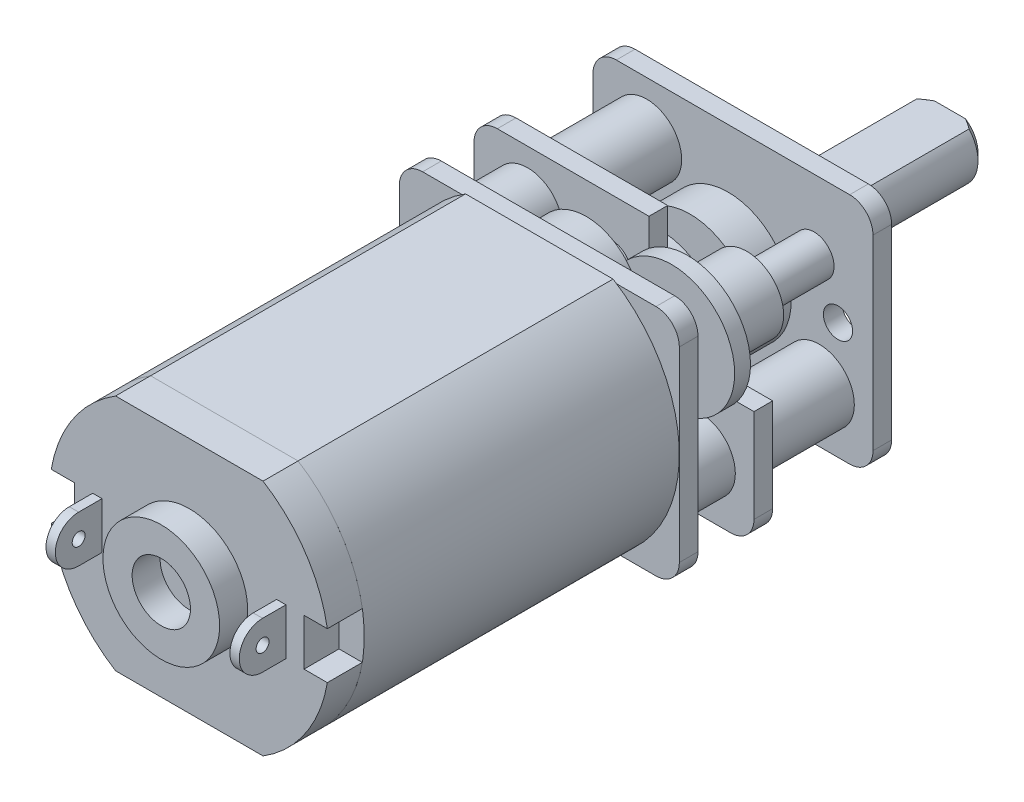
from build123d import *

# Parameters (mm, degrees)
BOSS_EXTRU_1_DEPTH                = 13.5
BOSS_EXTRU_2_DEPTH                = 1.5
ESQUISSE3_R                       = 2.5
ESQUISSE3_R_2                     = 1.25
BOSS_EXTRU_3_DEPTH                = 1.2
ESQUISSE4_W                       = 0.4
ESQUISSE4_H                       = 2
BOSS_EXTRU_4_DEPTH                = 2
ESQUISSE5_R                       = 0.277359655
ENL_V_MAT_EXTRU_1_DEPTH           = 0.4
BOSS_EXTRU_5_DEPTH                = 0.8
R_P_TITION_LIN_AIRE1_COUNT        = 2
R_P_TITION_LIN_AIRE1_PITCH        = 3.2
R_P_TITION_LIN_AIRE2_COUNT        = 2
R_P_TITION_LIN_AIRE2_PITCH        = 8.3
BOSS_EXTRU_6_REACH                = 29.262
ESQUISSE7_R                       = 1.5
ENL_V_MAT_EXTRU_2_DEPTH           = 0.8
ESQUISSE9_R                       = 2
BOSS_EXTRU_7_DEPTH                = 0.5
ESQUISSE13_W                      = 0.625
ESQUISSE13_H                      = 0.8
TROU_TARAUD_M1_6X0_351_AT_2_COUNT = 2
TROU_TARAUD_M1_6X0_351_AT_2_PITCH = 9
ESQUISSE17_R                      = 1.5
BOSS_EXTRU_8_DEPTH                = 8
CHANFREIN1_SIZE                   = 0.3
ENL_V_MAT_EXTRU_3_DEPTH           = 7.5
ENL_V_MAT_EXTRU_4_DEPTH           = 0.8


# Read off the part's stored shape, not the designer's step: Fraisage pour vis à tête fraisée M1.61
with BuildPart() as part:
    # Esquisse1 → Boss.-Extru.1 (new body)
    with BuildSketch(Plane.XY):
        with BuildLine():
            Line((3.160696126, 5.1), (-3.160696126, 5.1))
            ThreePointArc((-3.160696126, 5.1), (-6, 0), (-3.160696126, -5.1))
            Line((-3.160696126, -5.1), (3.160696126, -5.1))
            Line((3.160696126, -5.1), (3.160696126, 5.1))
        make_face()
        with BuildLine():
            ThreePointArc((6, 0), (5.242336156, 2.918546149), (3.160696126, 5.1))
            Line((3.160696126, 5.1), (3.160696126, -5.1))
            ThreePointArc((3.160696126, -5.1), (5.242336156, -2.918546149), (6, 0))
        make_face()
    extrude(amount=BOSS_EXTRU_1_DEPTH)


with BuildPart() as body_2:
    # Esquisse2 → Boss.-Extru.2 (new body)
    with BuildSketch(Plane.XY.offset(13.5)):
        with BuildLine():
            Line((-4.916079783, -1), (-5.916079783, -1))
            ThreePointArc((-5.916079783, -1), (-4.979906146, -3.346720002), (-3.160696126, -5.1))
            Line((-3.160696126, -5.1), (3.160696126, -5.1))
            ThreePointArc((3.160696126, -5.1), (4.979906146, -3.346720002), (5.916079783, -1))
            Line((5.916079783, -1), (4.916079783, -1))
            Line((4.916079783, -1), (4.916079783, 1))
            Line((4.916079783, 1), (5.916079783, 1))
            ThreePointArc((5.916079783, 1), (4.979906146, 3.346720002), (3.160696126, 5.1))
            Line((3.160696126, 5.1), (-3.160696126, 5.1))
            ThreePointArc((-3.160696126, 5.1), (-4.979906146, 3.346720002), (-5.916079783, 1))
            Line((-5.916079783, 1), (-4.916079783, 1))
            Line((-4.916079783, 1), (-4.916079783, -1))
        make_face()
    extrude(amount=BOSS_EXTRU_2_DEPTH)

    # Esquisse3 → Boss.-Extru.3 (add)
    with BuildSketch(Plane.XY.offset(15)):
        Circle(ESQUISSE3_R)
        Circle(ESQUISSE3_R_2, mode=Mode.SUBTRACT)
    extrude(amount=BOSS_EXTRU_3_DEPTH)

    # Esquisse4 → Boss.-Extru.4 (add)
    with BuildSketch(Plane.XY.offset(15)):
        with Locations((-3.940894392, 0)):
            Rectangle(ESQUISSE4_W, ESQUISSE4_H)
    boss_extru_4 = extrude(amount=BOSS_EXTRU_4_DEPTH)

    # Esquisse5 → Enlèv. mat.-Extru.1 (cut)
    with BuildSketch(Plane.ZY.offset(4.140894392)):
        with BuildLine():
            Line((17, 1), (16, 1))
            ThreePointArc((16, 1), (16.707106781, 0.707106781), (17, 0))
            Line((17, 0), (17, 1))
        make_face()
        with BuildLine():
            Line((17, -1), (17, 0))
            ThreePointArc((17, 0), (16.707106781, -0.707106781), (16, -1))
            Line((16, -1), (17, -1))
        make_face()
        with Locations((16, 0)):
            Circle(ESQUISSE5_R)
    enl_v_mat_extru_1 = extrude(amount=-ENL_V_MAT_EXTRU_1_DEPTH, mode=Mode.SUBTRACT)

    # Symétrie1: Boss.-Extru.4, Enlèv. mat.-Extru.1 across plane
    add(boss_extru_4.mirror(Plane(origin=(0, 0, 0), x_dir=(0, 0, 1), z_dir=(1, 0, 0))))
    add(enl_v_mat_extru_1.mirror(Plane(origin=(0, 0, 0), x_dir=(0, 0, 1), z_dir=(1, 0, 0))), mode=Mode.SUBTRACT)


with BuildPart() as body_3:
    # Esquisse6 → Boss.-Extru.5 (new body)
    with BuildSketch(Plane(origin=(0, 0, 0), x_dir=(-1, 0, 0), z_dir=(0, 0, -1))):
        with BuildLine():
            Line((-5, -5), (5, -5))
            ThreePointArc((5, -5), (5.707106781, -4.707106781), (6, -4))
            Line((6, -4), (6, 4))
            ThreePointArc((6, 4), (5.707106781, 4.707106781), (5, 5))
            Line((5, 5), (-5, 5))
            ThreePointArc((-5, 5), (-5.707106781, 4.707106781), (-6, 4))
            Line((-6, 4), (-6, -4))
            ThreePointArc((-6, -4), (-5.707106781, -4.707106781), (-5, -5))
        make_face()
    boss_extru_5 = extrude(amount=BOSS_EXTRU_5_DEPTH)

    # Boss.-Extru.6: up to this face of the body (flat: up to its plane)
    boss_extru_6_end = Plane(body_3.part.faces().sort_by_distance((0, 0, -0.8))[0])
    # Esquisse7 → Boss.-Extru.6 (add, up to the picked face)
    with BuildSketch(Plane(origin=(0, 0, -9.1), x_dir=(-1, 0, 0), z_dir=(0, 0, -1)), mode=Mode.PRIVATE) as boss_extru_6_sk1:
        with Locations(Location((3.7, 2.7, 0), (0, 0, 180))):
            Circle(ESQUISSE7_R)
    boss_extru_6_tool1 = split(extrude(boss_extru_6_sk1.sketch, amount=-BOSS_EXTRU_6_REACH, mode=Mode.PRIVATE), bisect_by=boss_extru_6_end, keep=Keep.BOTH, mode=Mode.PRIVATE)
    # Esquisse7 → Boss.-Extru.6 (add, up to the picked face)
    with BuildSketch(Plane(origin=(0, 0, -9.1), x_dir=(-1, 0, 0), z_dir=(0, 0, -1)), mode=Mode.PRIVATE) as boss_extru_6_sk2:
        with Locations(Location((-3.7, -2.7, 0), (0, 0, 180))):
            Circle(ESQUISSE7_R)
    boss_extru_6_tool2 = split(extrude(boss_extru_6_sk2.sketch, amount=-BOSS_EXTRU_6_REACH, mode=Mode.PRIVATE), bisect_by=boss_extru_6_end, keep=Keep.BOTH, mode=Mode.PRIVATE)


with BuildPart() as r_p_tition_lin_aire1_1:
    # Répétition linéaire1: Boss.-Extru.5 ×2
    with Locations(*[(0, 0, -i * R_P_TITION_LIN_AIRE1_PITCH) for i in range(1, R_P_TITION_LIN_AIRE1_COUNT)]):
        add(boss_extru_5)


with BuildPart() as r_p_tition_lin_aire2_1:
    # Répétition linéaire2: Boss.-Extru.5 ×2
    with Locations(*[(0, 0, -i * R_P_TITION_LIN_AIRE2_PITCH) for i in range(1, R_P_TITION_LIN_AIRE2_COUNT)]):
        add(boss_extru_5)


with BuildPart() as body_3_1:
    add(body_3.part)

    add(r_p_tition_lin_aire1_1.part)  # Boss.-Extru.6 merges Répétition linéaire1_1

    add(r_p_tition_lin_aire2_1.part)  # Boss.-Extru.6 merges Répétition linéaire2_1
    add(boss_extru_6_tool1.solids().sort_by(Axis((-3.7, 2.7, -9.1), (0, 0, 1)))[0])
    add(boss_extru_6_tool2.solids().sort_by(Axis((3.7, -2.7, -9.1), (0, 0, 1)))[0])

    # Esquisse8 → Enlèv. mat.-Extru.2 (cut)
    with BuildSketch(Plane(origin=(0, 0, -4), x_dir=(-1, 0, 0), z_dir=(0, 0, -1))):
        with BuildLine():
            Line((-1.5, 5.1), (-1.5, 1.5))
            ThreePointArc((-1.5, 1.5), (-1.939339828, 0.439339828), (-3, 0))
            Line((-3, 0), (-6, 0))
            Line((-6, 0), (-6, 5.1))
            Line((-6, 5.1), (-1.5, 5.1))
        make_face()
    extrude(amount=-ENL_V_MAT_EXTRU_2_DEPTH, mode=Mode.SUBTRACT)

    # Esquisse9 → Boss.-Extru.7 (add)
    with BuildSketch(Plane(origin=(0, 0, -9.1), x_dir=(-1, 0, 0), z_dir=(0, 0, -1))):
        Circle(ESQUISSE9_R)
    extrude(amount=BOSS_EXTRU_7_DEPTH)

    # Esquisse13 → Trou taraudé M1.6x0.351 (revolve, cut)
    with BuildSketch(Plane(origin=(4.5, 0, -9.1), x_dir=(0, 1, 0), z_dir=(1, 0, 0))):
        with Locations((0.3125, 0.4)):
            Rectangle(ESQUISSE13_W, ESQUISSE13_H)
    trou_taraud_m1_6x0_351 = revolve(axis=Axis((4.5, 0, -15.45), (0, 0, 1)), mode=Mode.SUBTRACT)

    # Trou taraudé M1.6x0.351 at 2: Trou taraudé M1.6x0.351 ×2
    with Locations(*[(-i * TROU_TARAUD_M1_6X0_351_AT_2_PITCH, 0, 0) for i in range(1, TROU_TARAUD_M1_6X0_351_AT_2_COUNT)]):
        add(trou_taraud_m1_6x0_351, mode=Mode.SUBTRACT)

    # Fraisage pour vis à tête fraisée M1.61 o → Fraisage pour vis à tête fraisée M1.61 (revolve, cut)
    with BuildSketch(Plane(origin=(-3.7, 2.7, 0), x_dir=(1, 0, 0), z_dir=(0, -1, 0))):
        Polygon((0.9, -4), (0, -4), (0, -9.1), (1.8, -9.1), (0.9, -8.2), align=None)
    revolve(axis=Axis((-3.7, 2.7, 0), (0, 0, 1)), mode=Mode.SUBTRACT)

    # Fraisage pour vis _ t_te frais_e M1. 2 → Fraisage pour vis _ t_te frais_e M1.61 2 (revolve, cut)
    with BuildSketch(Plane(origin=(3.7, -2.7, 0), x_dir=(1, 0, 0), z_dir=(0, -1, 0))):
        Polygon((0.9, -4), (0, -4), (0, -9.1), (1.8, -9.1), (0.9, -8.2), align=None)
    revolve(axis=Axis((3.7, -2.7, 0), (0, 0, 1)), mode=Mode.SUBTRACT)

    # Esquisse17 → Boss.-Extru.8 (add)
    with BuildSketch(Plane(origin=(0, 0, -9.6), x_dir=(-1, 0, 0), z_dir=(0, 0, -1))):
        Circle(ESQUISSE17_R)
    extrude(amount=BOSS_EXTRU_8_DEPTH)

    # Chanfrein1
    chanfrein1_edges = [body_3_1.edges().sort_by_distance(p)[0] for p in [
        (1.5, 0, -17.6),
    ]]
    chamfer(chanfrein1_edges, length=CHANFREIN1_SIZE)

    # Esquisse18 → Enlèv. mat.-Extru.3 (cut)
    with BuildSketch(Plane(origin=(0, 0, -17.6), x_dir=(-1, 0, 0), z_dir=(0, 0, -1))):
        with BuildLine():
            Line((-1.118033989, 1), (1.118033989, 1))
            ThreePointArc((1.118033989, 1), (0, 1.5), (-1.118033989, 1))
        make_face()
    extrude(amount=-ENL_V_MAT_EXTRU_3_DEPTH, mode=Mode.SUBTRACT)

    # Esquisse20 → Révolution2 (revolve)
    with BuildSketch(Plane(origin=(0, 2, 0), x_dir=(-1, 0, 0), z_dir=(0, 1, 0)), mode=Mode.PRIVATE) as r_volution2_sk:
        Polygon((-3.474579428, -0.8), (-2.617508768, -0.8), (-2.617508768, -2.196806681), (-0.774537165, -2.196806681), (-0.774537165, -2.876552377), (-1.893431831, -2.876552377), (-1.893431831, -5.414597353), (-2.617508768, -5.414597353), (-2.617508768, -8.3), (-3.474579428, -8.3), align=None)
    revolve(r_volution2_sk.sketch.rotate(Axis((3.474579428, 2, -0.8), (0, 0, -1)), 180), axis=Axis((3.474579428, 2, -0.8), (0, 0, -1)))


with BuildPart() as body_4:
    # Esquisse19 → Révolution1 (revolve)
    with BuildSketch(Plane(origin=(0, 0, 0), x_dir=(1, 0, 0), z_dir=(0, 1, 0))):
        Polygon((0, 0.8), (1.226963311, 0.8), (1.226963311, 2.036957743), (0.335913022, 2.036957743), (0.335913022, 4.207930806), (2.770785295, 4.207930806), (2.770785295, 5.16049073), (1.004185236, 5.16049073), (1.004185236, 6.457605051), (2.704247272, 6.457605051), (2.704247272, 8.089367495), (1.520080147, 8.089367495), (1.520080147, 8.3), (0, 8.3), align=None)
    revolve(axis=Axis((0, 0, 0), (0, 0, -1)))


with BuildPart() as body_5:
    # Esquisse21 → Révolution3 (revolve)
    with BuildSketch(Plane(origin=(0, -2, 0), x_dir=(-1, 0, 0), z_dir=(0, 1, 0))):
        Polygon((2.52248655, -8.3), (1.871364783, -8.3), (1.871364783, -6.457605051), (0.145478887, -6.457605051), (0.145478887, -5.280901037), (2.043772307, -5.280901037), (2.043772307, -4), (2.52248655, -4), align=None)
    revolve(axis=Axis((-2.52248655, -2, -1.56184198), (0, 0, -1)))


with BuildPart() as body_6:
    # Esquisse22 → Révolution4 (revolve)
    with BuildSketch(Plane(origin=(0, 0, 0), x_dir=(0, 0, -1), z_dir=(1, 0, 0))):
        Polygon((0.8, 2.78288325), (0.94274036, 2.78288325), (0.94274036, 4.836864208), (2.013432562, 4.836864208), (2.013432562, 3.436307107), (3.084124763, 3.436307107), (3.084124763, 2.78288325), (3.346335098, 2.78288325), (3.346335098, 2.552931448), (0.8, 2.552931448), align=None)
    revolve(axis=Axis((0, 2.552931448, -11.861833769), (0, 0, 1)))


with BuildPart() as body_7:
    # Esquisse23 → Révolution5 (revolve)
    with BuildSketch(Plane(origin=(0, 0, 0), x_dir=(-0.807790947859209, 0.5894690700594228, 0), z_dir=(0.5894690700594228, 0.807790947859209, 0)), mode=Mode.PRIVATE) as r_volution5_sk:
        Polygon((-5.480392996, -8.2), (-6.014725225, -8.734332228), (-6.014725225, -9.1), (-4.580392996, -9.1), (-4.580392996, -8.2), align=None)
    revolve(r_volution5_sk.sketch.rotate(Axis((3.7, -2.7, -4.657558661), (0, 0, -1)), 323.880659151), axis=Axis((3.7, -2.7, -4.657558661), (0, 0, -1)))


with BuildPart() as body_8:
    # Esquisse24 → Révolution6 (revolve)
    with BuildSketch(Plane(origin=(0, 0, 0), x_dir=(-0.807790947859209, 0.5894690700594228, 0), z_dir=(0.5894690700594228, 0.807790947859209, 0)), mode=Mode.PRIVATE) as r_volution6_sk:
        Polygon((4.580392996, -8.2), (3.680392996, -8.2), (3.146060768, -8.734332228), (3.146060768, -9.1), (4.580392996, -9.1), align=None)
    revolve(r_volution6_sk.sketch.rotate(Axis((-3.7, 2.7, -9.1), (0, 0, 1)), 216.119340849), axis=Axis((-3.7, 2.7, -9.1), (0, 0, 1)))


with BuildPart() as enl_v_mat_extru_4_tool:
    # Esquisse25 → Enlèv. mat.-Extru.4 (new body)
    with BuildSketch(Plane(origin=(0, 0, -9.1), x_dir=(-1, 0, 0), z_dir=(0, 0, -1))):
        Polygon((2.711166018, 2.510947404), (4.587392081, 3.175466952), (4.688833982, 2.889052596), (2.812607919, 2.224533048), align=None)
        Polygon((3.889052596, 1.711166018), (3.224533048, 3.587392081), (3.510947404, 3.688833982), (4.175466952, 1.812607919), align=None)
        Polygon((-4.366907642, -3.454166908), (-3.288477394, -1.781205859), (-3.033092358, -1.945833092), (-4.111522606, -3.618794141), align=None)
        Polygon((-4.618794141, -2.288477394), (-2.945833092, -3.366907642), (-2.781205859, -3.111522606), (-4.454166908, -2.033092358), align=None)
    extrude(amount=-ENL_V_MAT_EXTRU_4_DEPTH)


with BuildPart() as body_3_2:
    add(body_3_1.part)

    # Enlèv. mat.-Extru.4: cut by enl_v_mat_extru_4_tool
    add(enl_v_mat_extru_4_tool.part, mode=Mode.SUBTRACT)


with BuildPart() as body_7_1:
    add(body_7.part)

    # Enlèv. mat.-Extru.4: cut by enl_v_mat_extru_4_tool
    add(enl_v_mat_extru_4_tool.part, mode=Mode.SUBTRACT)


with BuildPart() as body_8_1:
    add(body_8.part)

    # Enlèv. mat.-Extru.4: cut by enl_v_mat_extru_4_tool
    add(enl_v_mat_extru_4_tool.part, mode=Mode.SUBTRACT)


solid = Compound([part.part, body_2.part, body_4.part, body_5.part, body_6.part, body_3_2.part, body_7_1.part, body_8_1.part])
